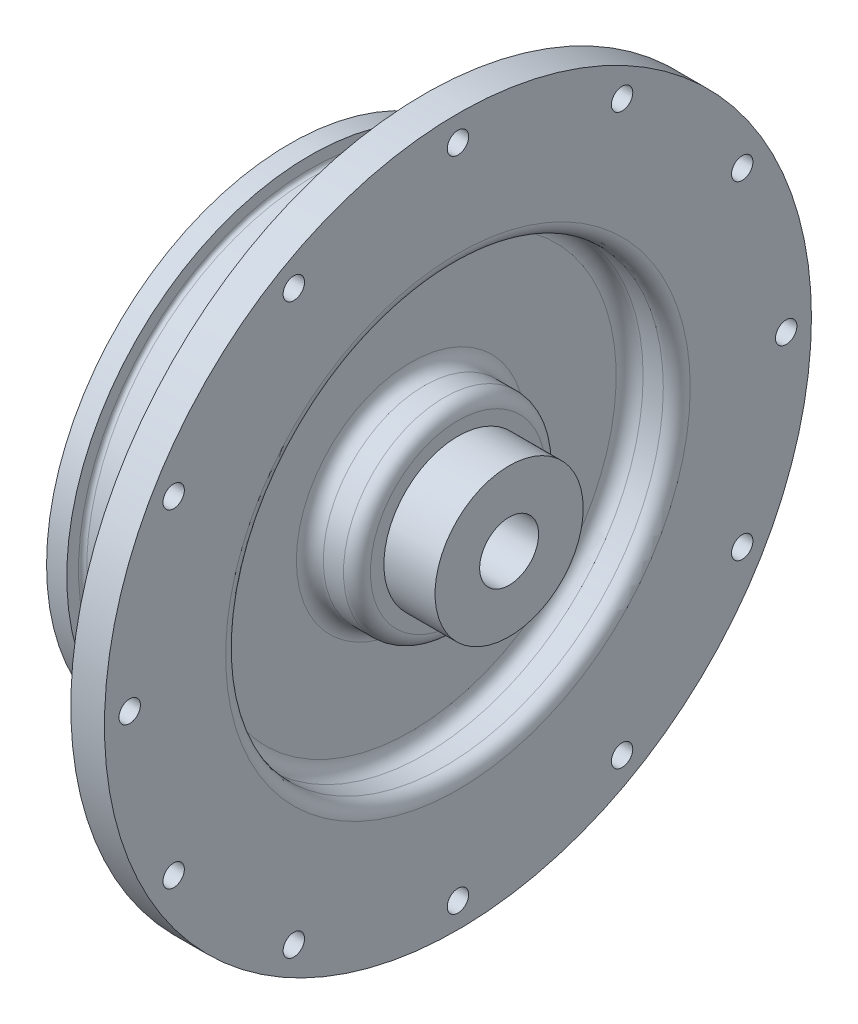
from build123d import *

# Parameters (mm, degrees)
SKETCH1_R               = 66.675
BOSS_EXTRUDE1_DEPTH     = 6.35
SKETCH2_R               = 45.847
BOSS_EXTRUDE2_DEPTH     = 25.4
SKETCH11_R              = 1.89865
CUT_EXTRUDE3_DEPTH      = 10.16
CIRPATTERN1_COUNT       = 10
CUT_EXTRUDE4_DEPTH      = 100.494591593
CUT_EXTRUDE4_DEPTH_BACK = 100.494591593
SKETCH15_R              = 5.55625
BOSS_EXTRUDE3_START     = 9.652
SKETCH17_R              = 13.97
SKETCH17_R_2            = 5.55625
BOSS_EXTRUDE3_DEPTH     = 9.652
SKETCH18_W              = 8.89
SKETCH18_H              = 22.225
FILLET1_R               = 2.54
SKETCH19_R              = 2.0193
CUT_EXTRUDE5_DEPTH      = 100.494591562


with BuildPart() as part:
    # Sketch1 → Boss-Extrude1 (new body)
    with BuildSketch(Plane(origin=(0, 0, 0), x_dir=(0, 0, -1), z_dir=(1, 0, 0))):
        Circle(SKETCH1_R)
    extrude(amount=BOSS_EXTRUDE1_DEPTH)

    # Sketch2 → Boss-Extrude2 (add)
    with BuildSketch(Plane.ZY):
        Circle(SKETCH2_R)
    extrude(amount=BOSS_EXTRUDE2_DEPTH)

    # Sketch11 → Cut-Extrude3 (cut)
    with BuildSketch(Plane(origin=(0, 0, -45.847), x_dir=(-1, 0, 0), z_dir=(0, 0, -1))):
        with Locations((7.62, 0)):
            Circle(SKETCH11_R)
    cut_extrude3 = extrude(amount=-CUT_EXTRUDE3_DEPTH, mode=Mode.SUBTRACT)

    # CirPattern1: Cut-Extrude3 ×10 about axis
    cirpattern1_axis = Axis((0, 0, 0), (-1, 0, 0))
    for i in range(1, CIRPATTERN1_COUNT):
        add(cut_extrude3.rotate(cirpattern1_axis, i * 360 / CIRPATTERN1_COUNT), mode=Mode.SUBTRACT)

    # Sketch15 → Cut-Extrude4 (cut, two sides: drawn at the far end of the back side and taken through both)
    with BuildSketch(Plane(origin=(6.35, 0, 0), x_dir=(0, 0, -1), z_dir=(1, 0, 0)).offset(-CUT_EXTRUDE4_DEPTH_BACK)):
        Circle(SKETCH15_R)
    extrude(amount=CUT_EXTRUDE4_DEPTH + CUT_EXTRUDE4_DEPTH_BACK, mode=Mode.SUBTRACT)

    # Sketch16 → Cut-Revolve1 (revolve, cut)
    with BuildSketch(Plane.XY):
        with BuildLine():
            Line((-21.59, 45.847), (-14.4018, 45.847))
            Line((-14.4018, 45.847), (-14.4018, 43.6245))
            ThreePointArc((-14.4018, 43.6245), (-14.624984633, 43.085684633), (-15.1638, 42.8625))
            Line((-15.1638, 42.8625), (-20.828, 42.8625))
            ThreePointArc((-20.828, 42.8625), (-21.366815367, 43.085684633), (-21.59, 43.6245))
            Line((-21.59, 43.6245), (-21.59, 45.847))
        make_face()
    revolve(axis=Axis((0, 0, 0), (-1, 0, 0)), mode=Mode.SUBTRACT)

    # Sketch17 → Boss-Extrude3 (add)
    with BuildSketch(Plane(origin=(6.35, 0, 0), x_dir=(0, 0, -1), z_dir=(1, 0, 0)).offset(BOSS_EXTRUDE3_START)):
        Circle(SKETCH17_R)
        Circle(SKETCH17_R_2, mode=Mode.SUBTRACT)
    extrude(amount=-BOSS_EXTRUDE3_DEPTH)

    # Sketch18 → Cut-Revolve2 (revolve, cut)
    with BuildSketch(Plane.XY):
        with Locations((1.905, 30.1625)):
            Rectangle(SKETCH18_W, SKETCH18_H)
    revolve(axis=Axis((0, 0, 0), (-1, 0, 0)), mode=Mode.SUBTRACT)

    # Fillet1
    fillet1_edges = [part.edges().sort_by_distance(p)[0] for p in [
        (6.35, -41.275, 0),
        (-2.54, -41.275, 0),
        (-2.54, -19.05, 0),
        (6.35, -19.05, 0),
    ]]
    fillet(fillet1_edges, radius=FILLET1_R)

    # Sketch19 → Cut-Extrude5 (cut, through all)
    with BuildSketch(Plane(origin=(6.35, 0, 0), x_dir=(0, 0, -1), z_dir=(1, 0, 0))):
        with Locations((0, 61.9125)):
            Circle(SKETCH19_R)
        with Locations((30.95625, 53.617797812)):
            Circle(SKETCH19_R)
        with Locations((53.617797812, 30.95625)):
            Circle(SKETCH19_R)
        with Locations((61.9125, 0)):
            Circle(SKETCH19_R)
        with Locations((53.617797812, -30.95625)):
            Circle(SKETCH19_R)
        with Locations((30.95625, -53.617797812)):
            Circle(SKETCH19_R)
        with Locations((0, -61.9125)):
            Circle(SKETCH19_R)
        with Locations((-30.95625, -53.617797812)):
            Circle(SKETCH19_R)
        with Locations((-53.617797812, -30.95625)):
            Circle(SKETCH19_R)
        with Locations((-61.9125, 0)):
            Circle(SKETCH19_R)
        with Locations((-53.617797812, 30.95625)):
            Circle(SKETCH19_R)
        with Locations((-30.95625, 53.617797812)):
            Circle(SKETCH19_R)
    extrude(amount=-CUT_EXTRUDE5_DEPTH, mode=Mode.SUBTRACT)


solid = part.part
